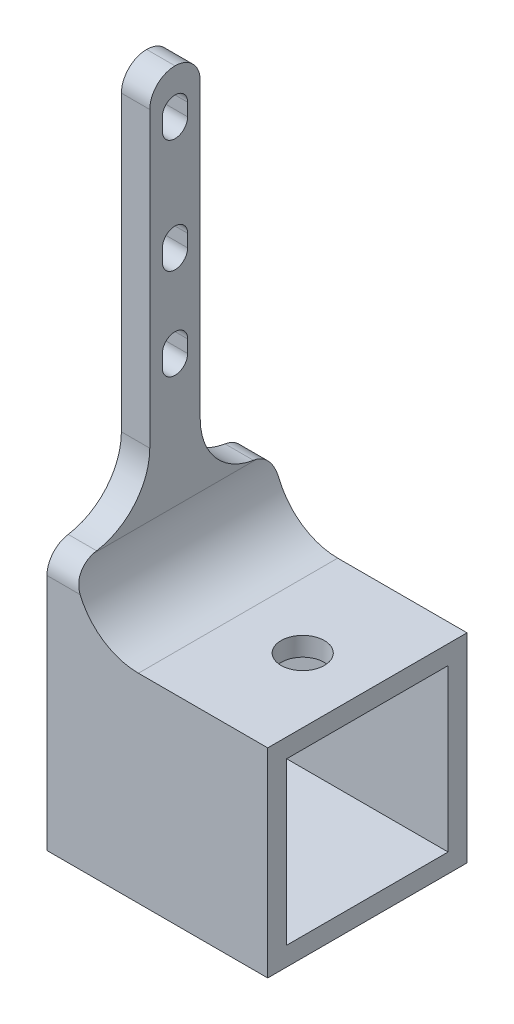
from build123d import *

# Parameters (mm, degrees)
SKETCH1_W           = 31.6
SKETCH1_H           = 31.6
SKETCH1_W_2         = 25.6
SKETCH1_H_2         = 25.6
BOSS_EXTRUDE1_DEPTH = 35
SKETCH2_W           = 4.5
SKETCH2_H           = 31.6
BOSS_EXTRUDE2_DEPTH = 70.5
FILLET1_R           = 10
SKETCH3_W           = 11.8
SKETCH3_H           = 60.5
CUT_EXTRUDE1_DEPTH  = 13
FILLET2_R           = 10
FILLET3_R           = 4
FILLET4_R           = 4
FILLET5_R           = 4
FILLET6_R           = 4
SKETCH4_R           = 3.43
CUT_EXTRUDE2_DEPTH  = 13
SKETCH6_W           = 4.5
SKETCH6_H           = 25.6
BOSS_EXTRUDE3_DEPTH = 26


# Some blends are built 0.0001 mm under size
with BuildPart() as part:
    # Sketch1 → Boss-Extrude1 (new body)
    with BuildSketch(Plane(origin=(0, 0, 0), x_dir=(0, 0, -1), z_dir=(1, 0, 0))):
        Rectangle(SKETCH1_W, SKETCH1_H)
        Rectangle(SKETCH1_W_2, SKETCH1_H_2, mode=Mode.SUBTRACT)
    extrude(amount=BOSS_EXTRUDE1_DEPTH)

    # Sketch2 → Boss-Extrude2 (add)
    with BuildSketch(Plane(origin=(0, 15.8, 0), x_dir=(1, 0, 0), z_dir=(0, 1, 0))):
        with Locations((2.25, 0)):
            Rectangle(SKETCH2_W, SKETCH2_H)
    extrude(amount=BOSS_EXTRUDE2_DEPTH)

    # Fillet1
    fillet1_edges = [part.edges().sort_by_distance(p)[0] for p in [
        (4.5, 15.8, 0),
    ]]
    fillet(fillet1_edges, radius=FILLET1_R)

    # Sketch3 → Cut-Extrude1 (cut)
    with BuildSketch(Plane(origin=(4.5, 0, 0), x_dir=(0, 0, -1), z_dir=(1, 0, 0))):
        with BuildLine():
            Line((-2, 45.8), (-2, 47.8))
            ThreePointArc((-2, 47.8), (0, 49.8), (2, 47.8))
            Line((2, 47.8), (2, 45.8))
            ThreePointArc((2, 45.8), (0, 43.8), (-2, 45.8))
        make_face()
        with BuildLine():
            Line((-2, 60.3), (-2, 62.3))
            ThreePointArc((-2, 62.3), (0, 64.3), (2, 62.3))
            Line((2, 62.3), (2, 60.3))
            ThreePointArc((2, 60.3), (0, 58.3), (-2, 60.3))
        make_face()
        with BuildLine():
            Line((-2, 78.3), (-2, 80.3))
            ThreePointArc((-2, 80.3), (0, 82.3), (2, 80.3))
            Line((2, 80.3), (2, 78.3))
            ThreePointArc((2, 78.3), (0, 76.3), (-2, 78.3))
        make_face()
        with Locations((-9.9, 56.05)):
            Rectangle(SKETCH3_W, SKETCH3_H)
        with Locations((9.9, 56.05)):
            Rectangle(SKETCH3_W, SKETCH3_H)
    extrude(amount=-CUT_EXTRUDE1_DEPTH, mode=Mode.SUBTRACT)

    # Fillet2
    fillet2_edges = [part.edges().sort_by_distance(p)[0] for p in [
        (2.25, 25.8, 4),
        (2.25, 25.8, -4),
    ]]
    fillet(fillet2_edges, radius=FILLET2_R)

    # Fillet3
    fillet3_edges = [part.edges().sort_by_distance(p)[0] for p in [
        (2.25, 86.3, 4),
    ]]
    fillet(fillet3_edges, radius=FILLET3_R)

    # Fillet4
    fillet4_edges = [part.edges().sort_by_distance(p)[0] for p in [
        (2.25, 86.3, -4),
    ]]
    fillet(fillet4_edges, radius=FILLET4_R - 0.0001)  # a hair under: the kernel refuses the full size

    # Fillet5
    # the kernel refuses this fillet: 4 mm, written as the material it takes off along each edge
    with BuildSketch(Plane(origin=(14.065155865, 25.8, 15.8), x_dir=(0, 0.03682620114116805, -0.9993216853994064), z_dir=(-1, 0, 0))) as fillet5_piece_1:
        with BuildLine():
            CenterArc((3.8563874, 3.970771877), FILLET5_R, 182.110463108, 80.958903851)
            Line((-0.140899342, 3.823467072), (-0.540628016, 3.808736592))
            Line((-0.540628016, 3.808736592), (-0.399728674, -0.01473048))
            Line((-0.399728674, -0.01473048), (0.01473048, -0.399728674))
            ThreePointArc((0.01473048, -0.399728674), (1.813509514, -0.333441512), (3.325449974, -0.397077188))
            Line((3.325449974, -0.397077188), (3.373717013, 0))
        make_face()
    extrude(amount=23.630311731, mode=Mode.SUBTRACT)

    # Fillet6
    # the kernel refuses this fillet: 4 mm, written as the material it takes off along each edge
    with BuildSketch(Plane(origin=(14.065155865, 25.8, -15.8), x_dir=(0, 0.03682620114116807, 0.9993216853994065), z_dir=(-1, 0, 0))) as fillet6_piece_1:
        with BuildLine():
            CenterArc((3.8563874, -3.970771877), FILLET6_R, 96.93063304, 80.958903851)
            Line((-0.140899342, -3.823467072), (-0.540628016, -3.808736592))
            Line((-0.540628016, -3.808736592), (-0.399728674, 0.01473048))
            Line((-0.399728674, 0.01473048), (0.01473048, 0.399728674))
            ThreePointArc((0.01473048, 0.399728674), (1.813509514, 0.333441512), (3.325449974, 0.397077188))
            Line((3.325449974, 0.397077188), (3.373717013, 0))
        make_face()
    extrude(amount=23.630311731, mode=Mode.SUBTRACT)

    # Sketch4 → Cut-Extrude2 (cut)
    with BuildSketch(Plane(origin=(0, 15.8, 0), x_dir=(1, 0, 0), z_dir=(0, 1, 0))):
        with Locations(Location((24.75, 0, 0), (0, 0, 270))):
            Circle(SKETCH4_R)
    extrude(amount=-CUT_EXTRUDE2_DEPTH, mode=Mode.SUBTRACT)

    # Sketch6 → Boss-Extrude3 (add)
    with BuildSketch(Plane(origin=(0, -12.8, 0), x_dir=(1, 0, 0), z_dir=(0, 1, 0))):
        with Locations((2.25, 0)):
            Rectangle(SKETCH6_W, SKETCH6_H)
    extrude(amount=BOSS_EXTRUDE3_DEPTH)


solid = part.part
